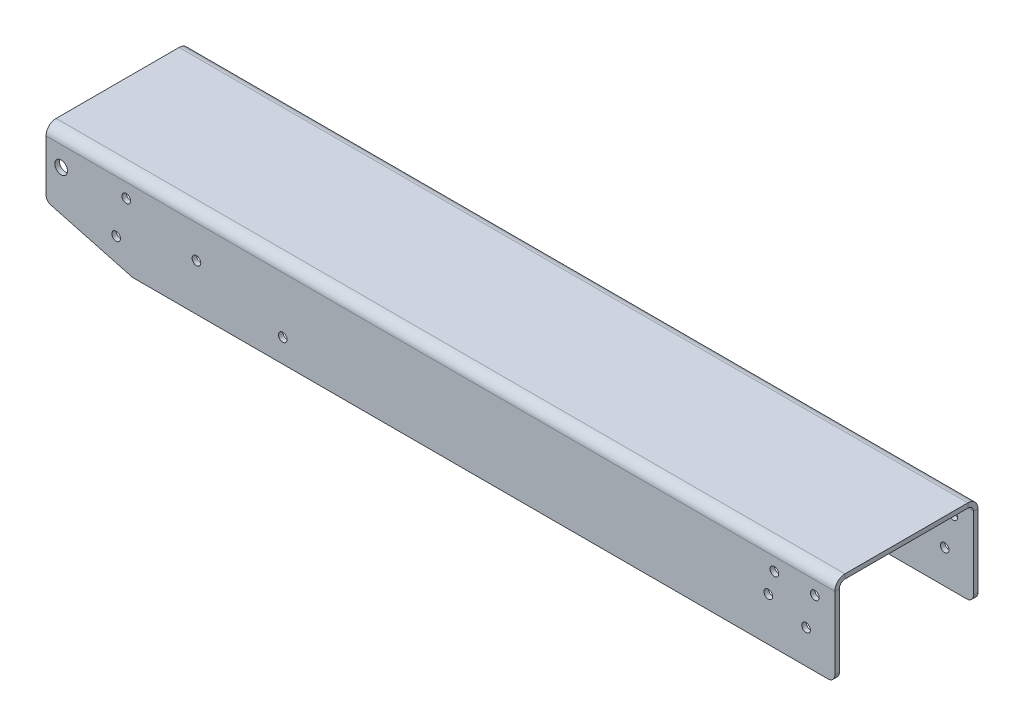
from build123d import *

# Parameters (mm, degrees)
BASE_FLANGE1_DEPTH           = 448.31
CUT_EXTRUDE1_DEPTH           = 459.458977562
F_1_4_CLEARANCE_HOLE1_D      = 7.2644
F_10_0_1935_DIAMETER_HOLE1_D = 4.9149
FILLET1_R                    = 3.81


# Sheet-metal steps are written as plain solids
with BuildPart() as part:
    # Sketch2 → Base-Flange1 (new body)
    with BuildSketch(Plane(origin=(0, 0, 0), x_dir=(0, 0, -1), z_dir=(1, 0, 0))):
        with BuildLine():
            Line((-40.68826, -50.8), (-40.68826, -5.76326))
            ThreePointArc((-40.68826, -5.76326), (-39.000240228, -1.688019772), (-34.925, 0))
            Line((-34.925, 0), (34.925, 0))
            ThreePointArc((34.925, 0), (39.000240228, -1.688019772), (40.68826, -5.76326))
            Line((40.68826, -5.76326), (40.68826, -50.8))
            Line((40.68826, -50.8), (38.1, -50.8))
            Line((38.1, -50.8), (38.1, -5.76326))
            ThreePointArc((38.1, -5.76326), (37.17006403, -3.51819597), (34.925, -2.58826))
            Line((34.925, -2.58826), (-34.925, -2.58826))
            ThreePointArc((-34.925, -2.58826), (-37.17006403, -3.51819597), (-38.1, -5.76326))
            Line((-38.1, -5.76326), (-38.1, -50.8))
            Line((-38.1, -50.8), (-40.68826, -50.8))
        make_face()
    extrude(amount=BASE_FLANGE1_DEPTH)

    # Sketch8 → Cut-Extrude1 (cut, through all)
    with BuildSketch(Plane.XY.offset(40.68826)):
        Polygon((0, -37.636171444), (49.128076995, -50.8), (0, -50.8), align=None)
    extrude(amount=-CUT_EXTRUDE1_DEPTH, mode=Mode.SUBTRACT)

    # 1/4 Clearance Hole1 (through all)
    with Locations(Plane.XY.offset(40.68826)):
        with Locations((8.61046841, -16.934326391)):
            Hole(F_1_4_CLEARANCE_HOLE1_D / 2)

    # #10 (0.1935) Diameter Hole1 (through all)
    with Locations(Plane.XY.offset(40.68826)):
        with Locations((410.50096824, -26.010505082), (413.952320207, -13.129884188), (436.899172539, -13.361871369), (431.968669729, -31.762758359), (39.880176489, -35.174025037), (45.632429766, -13.706323547), (85.501018246, -24.389079634), (134.570050222, -37.537087125)):
            Hole(F_10_0_1935_DIAMETER_HOLE1_D / 2)

    # Fillet1
    fillet1_edges = [part.edges().sort_by_distance(p)[0] for p in [
        (448.31, -50.8, 39.39413),
        (49.128076995, -50.8, -39.39413),
        (0, -37.636171444, -39.39413),
        (0, -37.636171444, 39.39413),
        (49.128076995, -50.8, 39.39413),
        (448.31, -50.8, -39.39413),
    ]]
    fillet(fillet1_edges, radius=FILLET1_R)


solid = part.part
